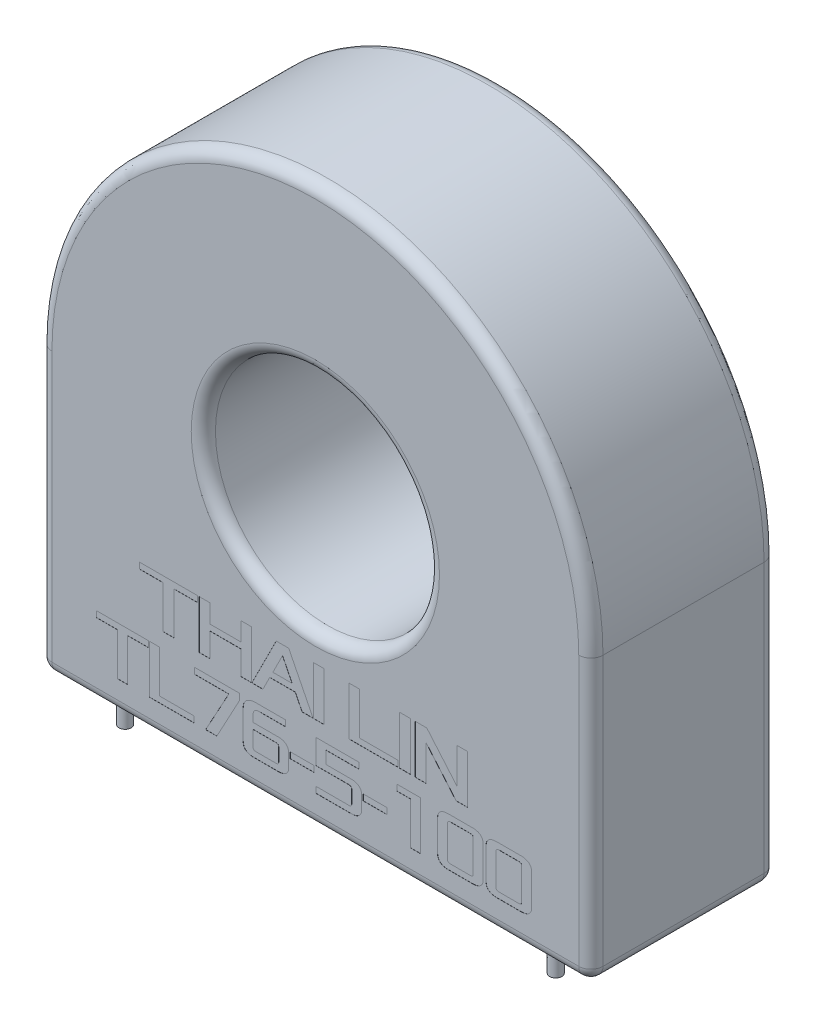
from build123d import *

# Parameters (mm, degrees)
SKETCH1_R           = 9.25
BOSS_EXTRUDE1_DEPTH = 7.65
SKETCH2_R           = 0.5
BOSS_EXTRUDE2_DEPTH = 2.5
FILLET1_R           = 1
SKETCH3_W           = 0.895944424
SKETCH3_H           = 4
SKETCH3_W_2         = 1.965215774
SKETCH3_H_2         = 0.500882695
CUT_EXTRUDE1_DEPTH  = 0.01
SKETCH4_W           = 0.682539037
SKETCH4_H           = 0.809522518
SKETCH4_W_2         = 0.682539036
CUT_EXTRUDE2_DEPTH  = 0.01


with BuildPart() as part:
    # Sketch1 → Boss-Extrude1 (new, symmetric)
    with BuildSketch(Plane.XY):
        with BuildLine():
            Line((-22.75, 11.625), (-22.75, -11.625))
            Line((-22.75, -11.625), (22.75, -11.625))
            Line((22.75, -11.625), (22.75, 11.625))
            ThreePointArc((22.75, 11.625), (0, 34.375), (-22.75, 11.625))
        make_face()
        with Locations((0, 11.625)):
            Circle(SKETCH1_R, mode=Mode.SUBTRACT)
    extrude(amount=BOSS_EXTRUDE1_DEPTH, both=True)

    # Sketch2 → Boss-Extrude2 (add, symmetric)
    with BuildSketch(Plane.XZ.offset(11.625)):
        with Locations((17.78, 5.58)):
            Circle(SKETCH2_R)
        with Locations((0, -4.58)):
            Circle(SKETCH2_R)
        with Locations((-17.78, 5.58)):
            Circle(SKETCH2_R)
    extrude(amount=BOSS_EXTRUDE2_DEPTH, both=True)

    # Fillet1
    fillet1_edges = [part.edges().sort_by_distance(p)[0] for p in [
        (-22.75, 0, -7.65),
        (0, 34.375, -7.65),
        (22.75, 0, 7.65),
        (-22.75, 0, 7.65),
        (-22.75, -11.625, 0),
        (22.75, -11.625, 0),
        (0, -11.625, -7.65),
        (0, -11.625, 7.65),
        (22.75, 0, -7.65),
        (0, 34.375, 7.65),
        (-9.25, 11.625, 7.65),
    ]]
    fillet(fillet1_edges, radius=FILLET1_R)

    # Sketch3 → Cut-Extrude1 (cut)
    # profile 1 of 17: a face of its own
    with BuildSketch(Plane.XY.offset(7.65)):
        Polygon((-14.532518498, -0.353325513), (-12.582011443, -0.353325513), (-12.582011443, -3.852442817), (-11.686067881, -3.852442817), (-11.686067881, -0.353325513), (-9.735560826, -0.353325513), (-9.735560826, 0.147557183), (-14.532518498, 0.147557183), align=None)
    # profile 2 of 17: a face of its own
    with BuildSketch(Plane.XY.offset(7.65)):
        Polygon((-9.590829785, -3.852442817), (-8.694885362, -3.852442817), (-8.694885362, -1.877134176), (-6.14814987, -1.877134176), (-6.14814987, -3.852442817), (-5.252205447, -3.852442817), (-5.252205447, 0.147557183), (-6.14814987, 0.147557183), (-6.14814987, -1.37625148), (-8.694885362, -1.37625148), (-8.694885362, 0.147557183), (-9.590829785, 0.147557183), align=None)
    # profile 3 of 17: a face of its own
    with BuildSketch(Plane.XY.offset(7.65)):
        Polygon((-5.244161293, -3.852442817), (-4.329861111, -3.852442817), (-3.769090333, -2.723695022), (-1.66010458, -2.723695022), (-1.099333802, -3.852442817), (-0.18503362, -3.852442817), (-2.19649402, 0.147557183), (-3.232700893, 0.147557183), align=None)
        Polygon((-3.506990947, -2.222812327), (-2.714597456, -0.642503409), (-1.922203965, -2.222812327), align=None, mode=Mode.SUBTRACT)
    # profile 4 of 17: a face of its own
    with BuildSketch(Plane.XY.offset(7.65)):
        with Locations((0.282186518, -1.852442817)):
            Rectangle(SKETCH3_W, SKETCH3_H)
    # profile 5 of 17: a face of its own
    with BuildSketch(Plane.XY.offset(7.65)):
        Polygon((2.768958574, -3.852441956), (6.834476962, -3.852441956), (6.834476962, -3.351560122), (3.664902998, -3.351560122), (3.664902998, 0.147557183), (2.768958574, 0.147557183), align=None)
    # profile 6 of 17: a face of its own
    with BuildSketch(Plane.XY.offset(7.65)):
        with Locations((7.393297629, -1.852442817)):
            Rectangle(SKETCH3_W, SKETCH3_H)
    # profile 7 of 17: a face of its own
    with BuildSketch(Plane.XY.offset(7.65)):
        Polygon((8.243385382, -3.852442817), (9.139329806, -3.852442817), (9.139329806, -0.943216627), (11.623966601, -3.852442817), (12.582009721, -3.852442817), (12.582009721, 0.147557183), (11.686065297, 0.147557183), (11.686065297, -2.761482996), (9.201445726, 0.147557183), (8.243385382, 0.147557183), align=None)
    # profile 8 of 17: a face of its own
    with BuildSketch(Plane.XY.offset(7.65)):
        Polygon((-18.07948547, -5.603325513), (-16.332627005, -5.603325513), (-16.332627005, -9.102442817), (-15.50370112, -9.102442817), (-15.50370112, -5.603325513), (-13.756842655, -5.603325513), (-13.756842655, -5.102442817), (-18.07948547, -5.102442817), align=None)
    # profile 9 of 17: a face of its own
    with BuildSketch(Plane.XY.offset(7.65)):
        Polygon((-13.685714286, -9.102441956), (-10.018143395, -9.102441956), (-10.018143395, -8.601560122), (-12.856788401, -8.601560122), (-12.856788401, -5.102442817), (-13.685714286, -5.102442817), align=None)
    # profile 10 of 17: a face of its own
    with BuildSketch(Plane.XY.offset(7.65)):
        Polygon((-9.988555101, -5.603325513), (-7.149910094, -5.603325513), (-9.060536541, -9.102442817), (-8.132517981, -9.102442817), (-6.253964809, -5.603325513), (-6.253964809, -5.102442817), (-9.988555101, -5.102442817), align=None)
    # profile 11 of 17: a face of its own
    with BuildSketch(Plane.XY.offset(7.65)):
        with BuildLine():
            add(Edge.make_bspline(
                [(-5.965079365, -8.386535527), (-5.964178551, -8.415925924), (-5.962440446, -8.4726342), (-5.95063423, -8.554660449), (-5.932548182, -8.630769718), (-5.906361096, -8.701259807), (-5.874585792, -8.766930613), (-5.832868082, -8.825283111), (-5.785951405, -8.87921949), (-5.731077978, -8.926583878), (-5.669764295, -8.967934365), (-5.603097775, -9.004373214), (-5.530557139, -9.03541711), (-5.451788042, -9.059642076), (-5.36750894, -9.079109267), (-5.277652274, -9.093183873), (-5.181857154, -9.100984664), (-5.116181002, -9.101946627), (-5.082363316, -9.102441956)],
                knots=[0, 0, 0, 0, 1.090546724, 2.104191533, 3.069975193, 3.988060192, 4.890652559, 5.768308273, 6.641681885, 7.538652629, 8.449449058, 9.381940305, 10.354600579, 11.372463556, 12.436293852, 13.562670226, 14.744980438, 16, 16, 16, 16], degree=3))
            Line((-5.082363316, -9.102441956), (-3.084338831, -9.102441956))
            add(Edge.make_bspline(
                [(-3.084338831, -9.102441956), (-3.050744649, -9.101941333), (-2.985292226, -9.100965956), (-2.889719867, -9.093184015), (-2.79986319, -9.079109233), (-2.715584102, -9.059642082), (-2.636814963, -9.03541712), (-2.564274471, -9.004373172), (-2.497607443, -8.967934513), (-2.436295588, -8.926583343), (-2.38141553, -8.879221432), (-2.334522937, -8.825276058), (-2.292714561, -8.766957424), (-2.261244951, -8.701062772), (-2.233671092, -8.630980299), (-2.215940006, -8.554628837), (-2.204063879, -8.472886893), (-2.202314117, -8.416420771), (-2.201410935, -8.387274408)],
                knots=[0, 0, 0, 0, 1.247794276, 2.431110226, 3.558444758, 4.623180007, 5.641908834, 6.615396507, 7.548680983, 8.460252186, 9.357985943, 10.232102494, 11.11050479, 12.013864952, 12.936550513, 13.903155723, 14.917662794, 16, 16, 16, 16], degree=3))
            Line((-2.201410935, -8.387274408), (-2.20140749, -7.342130352))
            add(Edge.make_bspline(
                [(-2.20140749, -7.342130352), (-2.202318865, -7.313042769), (-2.204086166, -7.25663736), (-2.215893147, -7.174927589), (-2.233896753, -7.098392458), (-2.260792507, -7.028017), (-2.293007433, -6.962470097), (-2.334486014, -6.904281387), (-2.381426042, -6.850359776), (-2.436291347, -6.802986296), (-2.497613766, -6.76165761), (-2.564252609, -6.725137721), (-2.636983969, -6.694379354), (-2.715411588, -6.668858204), (-2.799797083, -6.649313706), (-2.889857784, -6.636986831), (-2.985449521, -6.627305701), (-3.051177641, -6.626609714), (-3.085008818, -6.62625148)],
                knots=[0, 0, 0, 0, 1.079603584, 2.093521595, 3.059565557, 3.99192505, 4.885013636, 5.762905899, 6.636514906, 7.533727405, 8.444769315, 9.377511891, 10.350434321, 11.371899559, 12.436016582, 13.561057118, 14.74464218, 16, 16, 16, 16], degree=3))
            Line((-3.085008818, -6.62625148), (-5.13615348, -6.62625148))
            Line((-5.13615348, -6.62625148), (-5.13615348, -6.037295593))
            add(Edge.make_bspline(
                [(-5.13615348, -6.037295593), (-5.134669543, -6.003911441), (-5.131863069, -5.940774166), (-5.109887248, -5.851914284), (-5.071662187, -5.775539215), (-5.016131625, -5.713430919), (-4.945922492, -5.664285665), (-4.860067415, -5.630843446), (-4.760163091, -5.608269116), (-4.688325623, -5.60561293), (-4.65026455, -5.604205625)],
                knots=[0, 0, 0, 0, 1.078341341, 2.039396853, 2.936100315, 3.811247336, 4.704924793, 5.680758394, 6.771214737, 8, 8, 8, 8], degree=3))
            Line((-4.65026455, -5.604205625), (-2.477723008, -5.603325513))
            Line((-2.477723008, -5.603325513), (-2.477723008, -5.102442817))
            Line((-2.477723008, -5.102442817), (-4.866177869, -5.102442817))
            add(Edge.make_bspline(
                [(-4.866177869, -5.102442817), (-4.908269619, -5.103563399), (-4.990162799, -5.105743589), (-5.109341208, -5.114696909), (-5.221051232, -5.132427713), (-5.325501701, -5.157485777), (-5.423722659, -5.187375359), (-5.513734389, -5.226680498), (-5.597083234, -5.271836678), (-5.672845167, -5.32471404), (-5.741022297, -5.384413088), (-5.800067642, -5.451821757), (-5.851043602, -5.526016104), (-5.890766339, -5.608882975), (-5.924528279, -5.697668163), (-5.946261716, -5.794495207), (-5.962237991, -5.897924134), (-5.964114467, -5.969511356), (-5.965079365, -6.006322027)],
                knots=[0, 0, 0, 0, 1.248360097, 2.428793654, 3.540639795, 4.597573295, 5.611896563, 6.58001487, 7.504387576, 8.418265567, 9.313545441, 10.184224061, 11.068921664, 11.973149494, 12.902398245, 13.878991678, 14.90936207, 16, 16, 16, 16], degree=3))
            Line((-5.965079365, -6.006322027), (-5.965079365, -8.386535527))
        make_face()
        with BuildLine():
            Line((-5.13615348, -8.417253326), (-5.13615348, -7.127134176))
            Line((-5.13615348, -7.127134176), (-3.246324198, -7.127134176))
            add(Edge.make_bspline(
                [(-3.246324198, -7.127134176), (-3.229833231, -7.127833524), (-3.198922817, -7.129144371), (-3.155549365, -7.138180282), (-3.118284754, -7.151811502), (-3.086532423, -7.171619732), (-3.062686671, -7.198943809), (-3.044472063, -7.231267482), (-3.034167153, -7.269724557), (-3.031663443, -7.29697756), (-3.030335097, -7.311436665)],
                knots=[0, 0, 0, 0, 1.228569347, 2.302811313, 3.287526345, 4.174798407, 5.059089855, 5.961383309, 6.918410039, 8, 8, 8, 8], degree=3))
            Line((-3.030335097, -7.311436665), (-3.030333375, -8.417253326))
            add(Edge.make_bspline(
                [(-3.030333375, -8.417253326), (-3.031661142, -8.431715422), (-3.034163665, -8.458972994), (-3.044483913, -8.497407893), (-3.062644979, -8.529812795), (-3.086793953, -8.556964482), (-3.117972463, -8.577956677), (-3.155600481, -8.591275855), (-3.19889718, -8.600657094), (-3.229863094, -8.601245948), (-3.24638448, -8.601560122)],
                knots=[0, 0, 0, 0, 1.080018298, 2.035574722, 2.936481959, 3.819414846, 4.717395756, 5.700597943, 6.773189523, 8, 8, 8, 8], degree=3))
            Line((-3.24638448, -8.601560122), (-4.920172991, -8.601560122))
            add(Edge.make_bspline(
                [(-4.920172991, -8.601560122), (-4.936962248, -8.601249004), (-4.968192673, -8.600670281), (-5.011551634, -8.591468092), (-5.048724441, -8.577722577), (-5.079681832, -8.556979089), (-5.103925391, -8.529829418), (-5.12172559, -8.497248415), (-5.133711047, -8.459205719), (-5.135310243, -8.431758791), (-5.13615348, -8.417253326)],
                knots=[0, 0, 0, 0, 1.246449489, 2.318574743, 3.280947022, 4.178537522, 5.061086541, 5.961602094, 6.922980187, 8, 8, 8, 8], degree=3))
        make_face(mode=Mode.SUBTRACT)
    # profile 12 of 17: a face of its own
    with BuildSketch(Plane.XY.offset(7.65)):
        with Locations((-1.09770637, -7.441066726)):
            Rectangle(SKETCH3_W_2, SKETCH3_H_2)
    # profile 13 of 17: a face of its own
    with BuildSketch(Plane.XY.offset(7.65)):
        with BuildLine():
            Line((0.062433862, -9.102441956), (2.943174396, -9.102441956))
            add(Edge.make_bspline(
                [(2.943174396, -9.102441956), (2.976768578, -9.101941333), (3.042221001, -9.100965956), (3.13779336, -9.093184015), (3.227650038, -9.079109233), (3.311929126, -9.059642082), (3.390698265, -9.03541712), (3.463238756, -9.004373172), (3.529905784, -8.967934513), (3.59121764, -8.926583343), (3.646097698, -8.879221432), (3.692990291, -8.825276058), (3.734798666, -8.766957424), (3.766268277, -8.701062772), (3.793842135, -8.630980299), (3.811573222, -8.554628837), (3.823449348, -8.472886893), (3.82519911, -8.416420771), (3.826102293, -8.387274408)],
                knots=[0, 0, 0, 0, 1.247794276, 2.431110226, 3.558444758, 4.623180007, 5.641908834, 6.615396507, 7.548680983, 8.460252186, 9.357985943, 10.232102494, 11.11050479, 12.013864952, 12.936550513, 13.903155723, 14.917662794, 16, 16, 16, 16], degree=3))
            Line((3.826102293, -8.387274408), (3.826105737, -7.342130352))
            add(Edge.make_bspline(
                [(3.826105737, -7.342130352), (3.825194362, -7.313042769), (3.823427062, -7.25663736), (3.811620081, -7.174927589), (3.793616474, -7.098392458), (3.76672072, -7.028017), (3.734505794, -6.962470097), (3.693027214, -6.904281387), (3.646087186, -6.850359776), (3.59122188, -6.802986296), (3.529899461, -6.76165761), (3.463260618, -6.725137721), (3.390529258, -6.694379354), (3.31210164, -6.668858204), (3.227716144, -6.649313706), (3.137655444, -6.636986831), (3.042063706, -6.627305701), (2.976335586, -6.626609714), (2.942504409, -6.62625148)],
                knots=[0, 0, 0, 0, 1.079603584, 2.093521595, 3.059565557, 3.99192505, 4.885013636, 5.762905899, 6.636514906, 7.533727405, 8.444769315, 9.377511891, 10.350434321, 11.371899559, 12.436016582, 13.561057118, 14.74464218, 16, 16, 16, 16], degree=3))
            Line((2.942504409, -6.62625148), (0.891359747, -6.62625148))
            Line((0.891359747, -6.62625148), (0.891359747, -5.603325513))
            Line((0.891359747, -5.603325513), (3.605051257, -5.603325513))
            Line((3.605051257, -5.603325513), (3.605051257, -5.102442817))
            Line((3.605051257, -5.102442817), (0.062433862, -5.102442817))
            Line((0.062433862, -5.102442817), (0.062433862, -7.127134176))
            Line((0.062433862, -7.127134176), (2.781189029, -7.127134176))
            add(Edge.make_bspline(
                [(2.781189029, -7.127134176), (2.797679997, -7.127833524), (2.82859041, -7.129144371), (2.871963862, -7.138180282), (2.909228473, -7.151811502), (2.940980804, -7.171619732), (2.964826556, -7.198943809), (2.983041164, -7.231267482), (2.993346074, -7.269724557), (2.995849785, -7.29697756), (2.997178131, -7.311436665)],
                knots=[0, 0, 0, 0, 1.228569347, 2.302811313, 3.287526345, 4.174798407, 5.059089855, 5.961383309, 6.918410039, 8, 8, 8, 8], degree=3))
            Line((2.997178131, -7.311436665), (2.997179853, -8.417253326))
            add(Edge.make_bspline(
                [(2.997179853, -8.417253326), (2.995852085, -8.431715422), (2.993349562, -8.458972994), (2.983029314, -8.497407893), (2.964868248, -8.529812795), (2.940719274, -8.556964482), (2.909540764, -8.577956677), (2.871912747, -8.591275855), (2.828616048, -8.600657094), (2.797650133, -8.601245948), (2.781128748, -8.601560122)],
                knots=[0, 0, 0, 0, 1.080018298, 2.035574722, 2.936481959, 3.819414846, 4.717395756, 5.700597943, 6.773189523, 8, 8, 8, 8], degree=3))
            Line((2.781128748, -8.601560122), (0.062433862, -8.601560122))
            Line((0.062433862, -8.601560122), (0.062433862, -9.102441956))
        make_face()
    # profile 14 of 17: a face of its own
    with BuildSketch(Plane.XY.offset(7.65)):
        with Locations((4.929806858, -7.441066726)):
            Rectangle(SKETCH3_W_2, SKETCH3_H_2)
    # profile 15 of 17: a face of its own
    with BuildSketch(Plane.XY.offset(7.65)):
        Polygon((6.747720493, -5.603325513), (7.839507034, -5.603325513), (7.839507034, -9.102442817), (8.668432919, -9.102442817), (8.668432919, -5.102442817), (6.747720493, -5.102442817), align=None)
    # profile 16 of 17: a face of its own
    with BuildSketch(Plane.XY.offset(7.65)):
        with BuildLine():
            add(Edge.make_bspline(
                [(10.091358025, -8.387409611), (10.092271424, -8.416798847), (10.094033739, -8.473502486), (10.105629104, -8.555298605), (10.124272571, -8.631229451), (10.149613594, -8.701754478), (10.182147427, -8.767078187), (10.223531608, -8.825300742), (10.270496363, -8.879214637), (10.325356554, -8.926585214), (10.386673885, -8.967933996), (10.453339391, -9.004373318), (10.525880315, -9.03541708), (10.60464933, -9.059642085), (10.688928455, -9.079109265), (10.778785114, -9.093183874), (10.874580236, -9.100984664), (10.940256387, -9.101946627), (10.974074074, -9.102441956)],
                knots=[0, 0, 0, 0, 1.091324182, 2.105602559, 3.061388645, 3.990302777, 4.883708783, 5.761913066, 6.63583257, 7.533363956, 8.444729669, 9.377803759, 10.351071984, 11.369571165, 12.434066396, 13.5611468, 14.744196001, 16, 16, 16, 16], degree=3))
            Line((10.974074074, -9.102441956), (12.972098559, -9.102441956))
            add(Edge.make_bspline(
                [(12.972098559, -9.102441956), (13.00569274, -9.101941333), (13.071145163, -9.100965956), (13.166717524, -9.093184015), (13.256574195, -9.079109231), (13.340853306, -9.05964209), (13.419622363, -9.03541709), (13.492163143, -9.004373278), (13.558829153, -8.96793414), (13.620144673, -8.926584691), (13.675011432, -8.879216537), (13.721952331, -8.825293838), (13.763425995, -8.767104304), (13.795660331, -8.701561929), (13.82237742, -8.631435435), (13.840672649, -8.555267841), (13.852336458, -8.473757651), (13.854110658, -8.417298834), (13.855026455, -8.388156242)],
                knots=[0, 0, 0, 0, 1.248585623, 2.432652029, 3.560701514, 4.626112014, 5.645486916, 6.619591972, 7.553468334, 8.465617653, 9.36392075, 10.238591664, 11.11755104, 12.011725211, 12.945218025, 13.90182591, 14.916976379, 16, 16, 16, 16], degree=3))
            Line((13.855026455, -8.388156242), (13.8550299, -5.817603477))
            add(Edge.make_bspline(
                [(13.8550299, -5.817603477), (13.854112557, -5.788462915), (13.852335303, -5.732006206), (13.840672863, -5.650497895), (13.822377366, -5.574330315), (13.795660345, -5.504203818), (13.763425991, -5.438661443), (13.721952332, -5.380471908), (13.675011432, -5.32654921), (13.620144673, -5.279181056), (13.558829153, -5.237831606), (13.492163143, -5.201392469), (13.419622363, -5.170348655), (13.340853307, -5.146123665), (13.256574193, -5.126656481), (13.16671753, -5.112581873), (13.070922409, -5.104781083), (13.005246258, -5.10381912), (12.971428571, -5.103323791)],
                knots=[0, 0, 0, 0, 1.082394717, 2.097023559, 3.053139899, 3.986153045, 4.879867752, 5.758375482, 6.632596953, 7.530438465, 8.442119083, 9.37551558, 10.3491201, 11.367971205, 12.432834253, 13.560304098, 14.743762081, 16, 16, 16, 16], degree=3))
            Line((12.971428571, -5.103323791), (10.974279032, -5.102442817))
            add(Edge.make_bspline(
                [(10.974279032, -5.102442817), (10.940395427, -5.10331105), (10.874663976, -5.104995352), (10.778783452, -5.11252725), (10.688928865, -5.126669955), (10.604649228, -5.146120303), (10.52588034, -5.170349507), (10.453339385, -5.201392218), (10.386673887, -5.237831805), (10.325356553, -5.279180519), (10.270496364, -5.326551114), (10.223531605, -5.380465004), (10.182147436, -5.43868756), (10.149613558, -5.504011269), (10.124272715, -5.574536294), (10.105628537, -5.65046715), (10.094071026, -5.73201659), (10.092281653, -5.788469804), (10.091358025, -5.817609505)],
                knots=[0, 0, 0, 0, 1.259172173, 2.442692089, 3.570220939, 4.635139714, 5.654044138, 6.627699609, 7.561144954, 8.472873283, 9.370761781, 10.245029003, 11.123582708, 12.017344185, 12.946627916, 13.902794293, 14.917476233, 16, 16, 16, 16], degree=3))
            Line((10.091358025, -5.817609505), (10.091358025, -8.387409611))
        make_face()
        with BuildLine():
            Line((10.920283909, -8.418002541), (10.920283909, -5.787010546))
            add(Edge.make_bspline(
                [(10.920283909, -5.787010546), (10.921141484, -5.772712006), (10.922775523, -5.745467314), (10.934762925, -5.707682312), (10.952229908, -5.675085245), (10.977089643, -5.648802462), (11.007668426, -5.628002708), (11.044899632, -5.614310691), (11.087973216, -5.605145539), (11.1189321, -5.604532632), (11.135449735, -5.604205625)],
                knots=[0, 0, 0, 0, 1.068687892, 2.03629688, 2.942648866, 3.814683618, 4.718091592, 5.68670121, 6.765775135, 8, 8, 8, 8], degree=3))
            Line((11.135449735, -5.604205625), (12.810113192, -5.603325513))
            add(Edge.make_bspline(
                [(12.810113192, -5.603325513), (12.826610696, -5.604015565), (12.857533379, -5.60530899), (12.900826, -5.614455591), (12.938509813, -5.627778683), (12.969309569, -5.648813863), (12.994076253, -5.675102237), (13.011902417, -5.707522083), (13.02228881, -5.7458961), (13.024780385, -5.773161473), (13.026102293, -5.787627142)],
                knots=[0, 0, 0, 0, 1.229193561, 2.303982665, 3.289199236, 4.189019928, 5.057591977, 5.960344992, 6.917859159, 8, 8, 8, 8], degree=3))
            Line((13.026102293, -5.787627142), (13.026104015, -8.418002541))
            add(Edge.make_bspline(
                [(13.026104015, -8.418002541), (13.024784896, -8.432514035), (13.022302191, -8.459826005), (13.011902045, -8.498243414), (12.994076389, -8.530664262), (12.969309376, -8.556949177), (12.938510504, -8.577998001), (12.900823069, -8.591263307), (12.857544399, -8.600660893), (12.826575753, -8.60124727), (12.81005291, -8.601560122)],
                knots=[0, 0, 0, 0, 1.085029602, 2.042125889, 2.944484921, 3.812677906, 4.712105896, 5.696892497, 6.771212539, 8, 8, 8, 8], degree=3))
            Line((12.81005291, -8.601560122), (11.136264399, -8.601560122))
            add(Edge.make_bspline(
                [(11.136264399, -8.601560122), (11.119473651, -8.601250355), (11.088240453, -8.600674144), (11.044899463, -8.591455672), (11.007668457, -8.577762891), (10.977089664, -8.55696333), (10.952229797, -8.530680458), (10.934763379, -8.498083577), (10.922711229, -8.460101229), (10.921121922, -8.432645352), (10.920283909, -8.418002541)],
                knots=[0, 0, 0, 0, 1.248967675, 2.323258931, 3.287575479, 4.186979369, 5.05514909, 5.957483945, 6.920804297, 8, 8, 8, 8], degree=3))
        make_face(mode=Mode.SUBTRACT)
    # profile 17 of 17: a face of its own
    with BuildSketch(Plane.XY.offset(7.65)):
        with BuildLine():
            add(Edge.make_bspline(
                [(14.092768959, -8.387409611), (14.093682359, -8.416798847), (14.095444674, -8.473502486), (14.107040039, -8.555298605), (14.125683506, -8.631229451), (14.151024529, -8.701754478), (14.183558361, -8.767078187), (14.224942542, -8.825300742), (14.271907298, -8.879214637), (14.326767489, -8.926585214), (14.38808482, -8.967933996), (14.454750326, -9.004373318), (14.52729125, -9.03541708), (14.606060265, -9.059642085), (14.69033939, -9.079109265), (14.780196049, -9.093183874), (14.875991171, -9.100984664), (14.941667322, -9.101946627), (14.975485009, -9.102441956)],
                knots=[0, 0, 0, 0, 1.091324182, 2.105602559, 3.061388645, 3.990302777, 4.883708783, 5.761913066, 6.63583257, 7.533363956, 8.444729669, 9.377803759, 10.351071984, 11.369571165, 12.434066396, 13.5611468, 14.744196001, 16, 16, 16, 16], degree=3))
            Line((14.975485009, -9.102441956), (16.973509493, -9.102441956))
            add(Edge.make_bspline(
                [(16.973509493, -9.102441956), (17.007103675, -9.101941333), (17.072556098, -9.100965956), (17.168128459, -9.093184015), (17.25798513, -9.079109231), (17.342264241, -9.05964209), (17.421033297, -9.03541709), (17.493574078, -9.004373278), (17.560240087, -8.96793414), (17.621555608, -8.926584691), (17.676422367, -8.879216537), (17.723363266, -8.825293838), (17.76483693, -8.767104304), (17.797071266, -8.701561929), (17.823788355, -8.631435435), (17.842083583, -8.555267841), (17.853747393, -8.473757651), (17.855521593, -8.417298834), (17.85643739, -8.388156242)],
                knots=[0, 0, 0, 0, 1.248585623, 2.432652029, 3.560701514, 4.626112014, 5.645486916, 6.619591972, 7.553468334, 8.465617653, 9.36392075, 10.238591664, 11.11755104, 12.011725211, 12.945218025, 13.90182591, 14.916976379, 16, 16, 16, 16], degree=3))
            Line((17.85643739, -8.388156242), (17.856440834, -5.817603477))
            add(Edge.make_bspline(
                [(17.856440834, -5.817603477), (17.855523491, -5.788462915), (17.853746238, -5.732006206), (17.842083798, -5.650497895), (17.8237883, -5.574330315), (17.797071279, -5.504203818), (17.764836926, -5.438661443), (17.723363267, -5.380471908), (17.676422367, -5.32654921), (17.621555608, -5.279181056), (17.560240087, -5.237831606), (17.493574078, -5.201392469), (17.421033297, -5.170348655), (17.342264241, -5.146123665), (17.257985128, -5.126656481), (17.168128465, -5.112581873), (17.072333344, -5.104781083), (17.006657193, -5.10381912), (16.972839506, -5.103323791)],
                knots=[0, 0, 0, 0, 1.082394717, 2.097023559, 3.053139899, 3.986153045, 4.879867752, 5.758375482, 6.632596953, 7.530438465, 8.442119083, 9.37551558, 10.3491201, 11.367971205, 12.432834253, 13.560304098, 14.743762081, 16, 16, 16, 16], degree=3))
            Line((16.972839506, -5.103323791), (14.975689966, -5.102442817))
            add(Edge.make_bspline(
                [(14.975689966, -5.102442817), (14.941806362, -5.10331105), (14.876074911, -5.104995352), (14.780194387, -5.11252725), (14.690339799, -5.126669955), (14.606060162, -5.146120303), (14.527291275, -5.170349507), (14.45475032, -5.201392218), (14.388084821, -5.237831805), (14.326767488, -5.279180519), (14.271907299, -5.326551114), (14.22494254, -5.380465004), (14.183558371, -5.43868756), (14.151024493, -5.504011269), (14.12568365, -5.574536294), (14.107039472, -5.65046715), (14.095481961, -5.73201659), (14.093692588, -5.788469804), (14.092768959, -5.817609505)],
                knots=[0, 0, 0, 0, 1.259172173, 2.442692089, 3.570220939, 4.635139714, 5.654044138, 6.627699609, 7.561144954, 8.472873283, 9.370761781, 10.245029003, 11.123582708, 12.017344185, 12.946627916, 13.902794293, 14.917476233, 16, 16, 16, 16], degree=3))
            Line((14.092768959, -5.817609505), (14.092768959, -8.387409611))
        make_face()
        with BuildLine():
            Line((14.921694844, -8.418002541), (14.921694844, -5.787010546))
            add(Edge.make_bspline(
                [(14.921694844, -5.787010546), (14.922552419, -5.772712006), (14.924186458, -5.745467314), (14.936173859, -5.707682312), (14.953640843, -5.675085245), (14.978500578, -5.648802462), (15.009079361, -5.628002708), (15.046310566, -5.614310691), (15.089384151, -5.605145539), (15.120343035, -5.604532632), (15.13686067, -5.604205625)],
                knots=[0, 0, 0, 0, 1.068687892, 2.03629688, 2.942648866, 3.814683618, 4.718091592, 5.68670121, 6.765775135, 8, 8, 8, 8], degree=3))
            Line((15.13686067, -5.604205625), (16.811524126, -5.603325513))
            add(Edge.make_bspline(
                [(16.811524126, -5.603325513), (16.82802163, -5.604015565), (16.858944314, -5.60530899), (16.902236935, -5.614455591), (16.939920748, -5.627778683), (16.970720504, -5.648813863), (16.995487187, -5.675102237), (17.013313351, -5.707522083), (17.023699745, -5.7458961), (17.02619132, -5.773161473), (17.027513228, -5.787627142)],
                knots=[0, 0, 0, 0, 1.229193561, 2.303982665, 3.289199236, 4.189019928, 5.057591977, 5.960344992, 6.917859159, 8, 8, 8, 8], degree=3))
            Line((17.027513228, -5.787627142), (17.02751495, -8.418002541))
            add(Edge.make_bspline(
                [(17.02751495, -8.418002541), (17.02619583, -8.432514035), (17.023713126, -8.459826005), (17.01331298, -8.498243414), (16.995487323, -8.530664262), (16.970720311, -8.556949177), (16.939921439, -8.577998001), (16.902234004, -8.591263307), (16.858955334, -8.600660893), (16.827986688, -8.60124727), (16.811463845, -8.601560122)],
                knots=[0, 0, 0, 0, 1.085029602, 2.042125889, 2.944484921, 3.812677906, 4.712105896, 5.696892497, 6.771212539, 8, 8, 8, 8], degree=3))
            Line((16.811463845, -8.601560122), (15.137675333, -8.601560122))
            add(Edge.make_bspline(
                [(15.137675333, -8.601560122), (15.120884586, -8.601250355), (15.089651388, -8.600674144), (15.046310398, -8.591455672), (15.009079392, -8.577762891), (14.978500598, -8.55696333), (14.953640732, -8.530680458), (14.936174313, -8.498083577), (14.924122164, -8.460101229), (14.922532857, -8.432645352), (14.921694844, -8.418002541)],
                knots=[0, 0, 0, 0, 1.248967675, 2.323258931, 3.287575479, 4.186979369, 5.05514909, 5.957483945, 6.920804297, 8, 8, 8, 8], degree=3))
        make_face(mode=Mode.SUBTRACT)
    extrude(amount=-CUT_EXTRUDE1_DEPTH, mode=Mode.SUBTRACT)

    # Sketch4 → Cut-Extrude2 (cut)
    # profile 1 of 6: a face of its own
    with BuildSketch(Plane.XZ.offset(11.625)):
        Polygon((-20.51172121, 2.121201377), (-20.003094908, 2.121201377), (-20.003094908, 1.359296615), (-19.542776802, 1.359296615), (-19.542776802, 2.121201377), (-18.860237765, 2.121201377), (-18.860237765, 1.359296615), (-18.399919013, 1.359296615), (-18.399919013, 2.121201377), (-17.891292711, 2.121201377), (-17.891292711, 2.454535356), (-18.399919013, 2.454535356), (-18.399919013, 3.264057874), (-17.891292711, 3.264057874), (-17.891292711, 3.597391853), (-18.399919013, 3.597391853), (-18.399919013, 4.359296615), (-18.860237765, 4.359296615), (-18.860237765, 3.597391853), (-19.542776802, 3.597391853), (-19.542776802, 4.359296615), (-20.003094908, 4.359296615), (-20.003094908, 3.597391853), (-20.51172121, 3.597391853), (-20.51172121, 3.264057874), (-20.003094908, 3.264057874), (-20.003094908, 2.454535356), (-20.51172121, 2.454535356), align=None)
        with Locations((-19.201507283, 2.859296615)):
            Rectangle(SKETCH4_W, SKETCH4_H, mode=Mode.SUBTRACT)
    # profile 2 of 6: a face of its own
    with BuildSketch(Plane.XZ.offset(11.625)):
        with BuildLine():
            Line((-17.806261115, 1.359297261), (-15.31421377, 1.359297261))
            Line((-15.31421377, 1.359297261), (-15.31421377, 1.734958637))
            Line((-15.31421377, 1.734958637), (-17.261304363, 1.734958637))
            Line((-17.261304363, 1.734958637), (-17.261304363, 2.702569314))
            add(Edge.make_bspline(
                [(-17.261304363, 2.702569314), (-17.260813843, 2.713410697), (-17.259889907, 2.733831379), (-17.252545127, 2.762446148), (-17.240403536, 2.786626291), (-17.224654771, 2.80708354), (-17.203600247, 2.822139998), (-17.178721083, 2.83249803), (-17.149666651, 2.83939422), (-17.128844844, 2.839866393), (-17.117777448, 2.840117367)],
                knots=[0, 0, 0, 0, 1.146140253, 2.15885418, 3.097687754, 3.993824496, 4.861583543, 5.801864819, 6.831627206, 8, 8, 8, 8], degree=3))
            Line((-17.117777448, 2.840117367), (-15.895227767, 2.840778097))
            add(Edge.make_bspline(
                [(-15.895227767, 2.840778097), (-15.873044614, 2.840768377), (-15.82978166, 2.840749422), (-15.767034905, 2.848234568), (-15.707485419, 2.857273583), (-15.65241537, 2.872960792), (-15.600554983, 2.891220266), (-15.552896145, 2.91470548), (-15.508491264, 2.941477222), (-15.468264176, 2.972973521), (-15.432514837, 3.008733129), (-15.401081673, 3.048836201), (-15.374306633, 3.093368413), (-15.353664961, 3.142859074), (-15.335949941, 3.195760675), (-15.324686744, 3.253351194), (-15.316172915, 3.314734838), (-15.315310483, 3.357280167), (-15.314867395, 3.379138531)],
                knots=[0, 0, 0, 0, 1.17725594, 2.295957155, 3.352944716, 4.372886693, 5.332411035, 6.269957519, 7.189856749, 8.082439236, 8.976787012, 9.869369499, 10.783210544, 11.727389576, 12.712515132, 13.741493687, 14.839655177, 16, 16, 16, 16], degree=3))
            Line((-15.314867395, 3.379138531), (-15.31421377, 3.820894845))
            add(Edge.make_bspline(
                [(-15.31421377, 3.820894845), (-15.314942364, 3.842543705), (-15.316366752, 3.884866865), (-15.32464591, 3.946065255), (-15.335960091, 4.003653498), (-15.35366241, 4.056555675), (-15.374307287, 4.10604616), (-15.401081484, 4.150578528), (-15.432514963, 4.190681155), (-15.468263857, 4.226442389), (-15.508492424, 4.257932573), (-15.552891644, 4.284727953), (-15.600572293, 4.308122043), (-15.652293581, 4.326718634), (-15.70768631, 4.340973211), (-15.766891113, 4.351750271), (-15.829962431, 4.357524562), (-15.873278008, 4.358258448), (-15.895555226, 4.358635885)],
                knots=[0, 0, 0, 0, 1.150395952, 2.249004896, 3.278402715, 4.263929667, 5.208493411, 6.122706807, 7.015652983, 7.910365167, 8.803311343, 9.723585392, 10.661513885, 11.621429193, 12.63875548, 13.698183835, 14.816175116, 16, 16, 16, 16], degree=3))
            Line((-15.895555226, 4.358635885), (-17.624608864, 4.359296615))
            Line((-17.624608864, 4.359296615), (-17.624608864, 3.983634594))
            Line((-17.624608864, 3.983634594), (-16.00307592, 3.983634594))
            add(Edge.make_bspline(
                [(-16.00307592, 3.983634594), (-15.992117988, 3.983073385), (-15.971432664, 3.98201399), (-15.942227888, 3.975587481), (-15.917695935, 3.964193424), (-15.896455156, 3.949332058), (-15.880757928, 3.928804238), (-15.868419068, 3.904466967), (-15.861483635, 3.875519617), (-15.859973762, 3.854920706), (-15.859179564, 3.844085621)],
                knots=[0, 0, 0, 0, 1.156202653, 2.182567429, 3.129214472, 3.994110424, 4.887290441, 5.823026416, 6.854905793, 8, 8, 8, 8], degree=3))
            Line((-15.859179564, 3.844085621), (-15.859170522, 3.35592967))
            add(Edge.make_bspline(
                [(-15.859170522, 3.35592967), (-15.859949297, 3.344888067), (-15.861417189, 3.32407605), (-15.868471853, 3.294995276), (-15.880509616, 3.270607713), (-15.896906697, 3.250787217), (-15.917422627, 3.23508315), (-15.942276001, 3.223918799), (-15.971485777, 3.21721159), (-15.992297449, 3.216707864), (-16.003359459, 3.216440118)],
                knots=[0, 0, 0, 0, 1.162461453, 2.19109177, 3.123881412, 3.996272323, 4.87234941, 5.816015764, 6.839148844, 8, 8, 8, 8], degree=3))
            Line((-16.003359459, 3.216440118), (-17.225354979, 3.216440118))
            add(Edge.make_bspline(
                [(-17.225354979, 3.216440118), (-17.247719372, 3.216167481), (-17.291155029, 3.21563797), (-17.354128025, 3.208450416), (-17.413508173, 3.198983626), (-17.468989508, 3.184658597), (-17.520421641, 3.16510828), (-17.568264116, 3.141919969), (-17.612641073, 3.115063714), (-17.652868779, 3.083585043), (-17.688642483, 3.047836472), (-17.719860509, 3.007820622), (-17.746839572, 2.963886553), (-17.7675999, 2.914851754), (-17.78517417, 2.862113783), (-17.796389937, 2.804742775), (-17.805004834, 2.743592083), (-17.805838822, 2.701262837), (-17.806269512, 2.679403081)],
                knots=[0, 0, 0, 0, 1.188934453, 2.309123595, 3.367517, 4.385781481, 5.350652488, 6.289445953, 7.210568694, 8.104338359, 8.99987566, 9.893645325, 10.798653009, 11.733336022, 12.719771842, 13.750118988, 14.838111863, 16, 16, 16, 16], degree=3))
            Line((-17.806269512, 2.679403081), (-17.806261115, 1.359297261))
        make_face()
    # profile 3 of 6: a face of its own
    with BuildSketch(Plane.XZ.offset(11.625)):
        Polygon((15.831135932, 2.121201377), (16.339762235, 2.121201377), (16.339762235, 1.359296615), (16.800080341, 1.359296615), (16.800080341, 2.121201377), (17.482619377, 2.121201377), (17.482619377, 1.359296615), (17.942938129, 1.359296615), (17.942938129, 2.121201377), (18.451564432, 2.121201377), (18.451564432, 2.454535356), (17.942938129, 2.454535356), (17.942938129, 3.264057874), (18.451564432, 3.264057874), (18.451564432, 3.597391853), (17.942938129, 3.597391853), (17.942938129, 4.359296615), (17.482619377, 4.359296615), (17.482619377, 3.597391853), (16.800080341, 3.597391853), (16.800080341, 4.359296615), (16.339762235, 4.359296615), (16.339762235, 3.597391853), (15.831135932, 3.597391853), (15.831135932, 3.264057874), (16.339762235, 3.264057874), (16.339762235, 2.454535356), (15.831135932, 2.454535356), align=None)
        with Locations((17.141349859, 2.859296615)):
            Rectangle(SKETCH4_W_2, SKETCH4_H, mode=Mode.SUBTRACT)
    # profile 4 of 6: a face of its own
    with BuildSketch(Plane.XZ.offset(11.625)):
        Polygon((18.995172856, 3.983634594), (19.721781859, 3.983634594), (19.721781859, 1.359296615), (20.266738611, 1.359296615), (20.266738611, 4.359296615), (18.995172856, 4.359296615), align=None)
    # profile 5 of 6: a face of its own
    with BuildSketch(Plane.XZ.offset(11.625)):
        Polygon((-2.451023271, -2.924591128), (-1.942396968, -2.924591128), (-1.942396968, -3.68649589), (-1.482078862, -3.68649589), (-1.482078862, -2.924591128), (-0.799539826, -2.924591128), (-0.799539826, -3.68649589), (-0.339221074, -3.68649589), (-0.339221074, -2.924591128), (0.169405229, -2.924591128), (0.169405229, -2.591257149), (-0.339221074, -2.591257149), (-0.339221074, -1.781734631), (0.169405229, -1.781734631), (0.169405229, -1.448400652), (-0.339221074, -1.448400652), (-0.339221074, -0.68649589), (-0.799539826, -0.68649589), (-0.799539826, -1.448400652), (-1.482078862, -1.448400652), (-1.482078862, -0.68649589), (-1.942396968, -0.68649589), (-1.942396968, -1.448400652), (-2.451023271, -1.448400652), (-2.451023271, -1.781734631), (-1.942396968, -1.781734631), (-1.942396968, -2.591257149), (-2.451023271, -2.591257149), align=None)
        with Locations((-1.140809344, -2.18649589)):
            Rectangle(SKETCH4_W_2, SKETCH4_H, mode=Mode.SUBTRACT)
    # profile 6 of 6: a face of its own
    with BuildSketch(Plane.XZ.offset(11.625)):
        with BuildLine():
            Line((0.31234401, -3.686495244), (2.165196968, -3.686495244))
            add(Edge.make_bspline(
                [(2.165196968, -3.686495244), (2.187456083, -3.686117325), (2.230753537, -3.685382214), (2.293806823, -3.679609641), (2.353011643, -3.668832573), (2.408404314, -3.654577967), (2.460125802, -3.635981491), (2.507805737, -3.612586983), (2.552207537, -3.585793115), (2.592426779, -3.554297467), (2.6282103, -3.518556527), (2.659397368, -3.478526951), (2.686599604, -3.434468598), (2.706853945, -3.385229205), (2.724887115, -3.332663487), (2.735918674, -3.275447949), (2.744574779, -3.21431171), (2.74540289, -3.171980402), (2.745830545, -3.150119582)],
                knots=[0, 0, 0, 0, 1.184591709, 2.304215717, 3.365191274, 4.384003276, 5.345320455, 6.284618709, 7.206236738, 8.100486983, 8.996505814, 9.890756059, 10.796250366, 11.742193562, 12.718008063, 13.748909226, 14.837487115, 16, 16, 16, 16], degree=3))
            Line((2.745830545, -3.150119582), (2.74648417, -2.481453288))
            add(Edge.make_bspline(
                [(2.74648417, -2.481453288), (2.744708247, -2.449214672), (2.741354624, -2.388335817), (2.726725534, -2.30248528), (2.701941591, -2.228121704), (2.667042993, -2.165188908), (2.624119027, -2.114004626), (2.579673794, -2.068275388), (2.528545261, -2.033212029), (2.492091765, -2.015425804), (2.474005148, -2.006601064)],
                knots=[0, 0, 0, 0, 1.330908233, 2.513264541, 3.579924902, 4.548633975, 5.460195297, 6.328093389, 7.170473682, 8, 8, 8, 8], degree=3))
            add(Edge.make_bspline(
                [(2.474005148, -2.006601064), (2.492168667, -1.997879604), (2.529007756, -1.980190817), (2.578994376, -1.943408579), (2.62462786, -1.898600084), (2.666961442, -1.846560793), (2.701973217, -1.783098441), (2.726676894, -1.70804627), (2.741505696, -1.621579122), (2.744333713, -1.560234164), (2.745830545, -1.527765085)],
                knots=[0, 0, 0, 0, 0.82484488, 1.672943141, 2.529622554, 3.443089913, 4.41423265, 5.483430246, 6.668012739, 8, 8, 8, 8], degree=3))
            Line((2.745830545, -1.527765085), (2.74648417, -1.22489766))
            add(Edge.make_bspline(
                [(2.74648417, -1.22489766), (2.745755576, -1.2032488), (2.744331187, -1.16092564), (2.73605203, -1.09972725), (2.724737848, -1.042139006), (2.70703553, -0.98923683), (2.686390653, -0.939746345), (2.659616456, -0.895213977), (2.628182977, -0.85511135), (2.592434083, -0.819350116), (2.552205516, -0.787859932), (2.507806296, -0.761064552), (2.460125647, -0.737670462), (2.408404359, -0.719073871), (2.35301163, -0.704819294), (2.293806827, -0.694042234), (2.230735509, -0.688267942), (2.187419931, -0.687534057), (2.165142714, -0.687156619)],
                knots=[0, 0, 0, 0, 1.150395952, 2.249004896, 3.278402715, 4.263929667, 5.208493411, 6.122706807, 7.015652983, 7.910365167, 8.803311343, 9.723585392, 10.661513885, 11.621429193, 12.63875548, 13.698183835, 14.816175116, 16, 16, 16, 16], degree=3))
            Line((2.165142714, -0.687156619), (0.31234401, -0.68649589))
            Line((0.31234401, -0.68649589), (0.31234401, -1.062157911))
            Line((0.31234401, -1.062157911), (2.056205617, -1.062157911))
            add(Edge.make_bspline(
                [(2.056205617, -1.062157911), (2.067186853, -1.062744765), (2.088103163, -1.063862565), (2.117649051, -1.070039535), (2.142405691, -1.081817163), (2.164206273, -1.096210808), (2.179919295, -1.117018189), (2.192285133, -1.141316495), (2.199212468, -1.170275542), (2.200723545, -1.190872714), (2.201518375, -1.201706884)],
                knots=[0, 0, 0, 0, 1.153028026, 2.196209313, 3.137585404, 4.016415305, 4.904622076, 5.835147853, 6.861281702, 8, 8, 8, 8], degree=3))
            Line((2.201518375, -1.201706884), (2.201527418, -1.689862834))
            add(Edge.make_bspline(
                [(2.201527418, -1.689862834), (2.200747945, -1.700903486), (2.199278737, -1.721713707), (2.192232804, -1.750806395), (2.180166266, -1.775154694), (2.163755598, -1.795247833), (2.142672804, -1.810492942), (2.11760107, -1.822037572), (2.088080544, -1.828493373), (2.067069433, -1.829056259), (2.05601573, -1.829352387)],
                knots=[0, 0, 0, 0, 1.156521359, 2.17989545, 3.107918604, 3.975851661, 4.865860744, 5.80470503, 6.84508071, 8, 8, 8, 8], degree=3))
            Line((2.05601573, -1.829352387), (0.639318061, -1.829352387))
            Line((0.639318061, -1.829352387), (0.639318061, -2.205014408))
            Line((0.639318061, -2.205014408), (2.056205617, -2.205014408))
            add(Edge.make_bspline(
                [(2.056205617, -2.205014408), (2.067196862, -2.205579216), (2.088132221, -2.206655023), (2.117461407, -2.213098745), (2.142566554, -2.223873623), (2.164181569, -2.238457066), (2.179934984, -2.259197683), (2.192147838, -2.283334046), (2.199303299, -2.312003216), (2.200749646, -2.332400281), (2.201518375, -2.343241276)],
                knots=[0, 0, 0, 0, 1.15763071, 2.204974548, 3.140653969, 4.022990617, 4.914741553, 5.848980358, 6.856737935, 8, 8, 8, 8], degree=3))
            Line((2.201518375, -2.343241276), (2.201527418, -3.172603771))
            add(Edge.make_bspline(
                [(2.201527418, -3.172603771), (2.200755953, -3.183446998), (2.199304533, -3.203847241), (2.192138179, -3.232499643), (2.17996929, -3.25669742), (2.163979688, -3.277325856), (2.142802742, -3.29275167), (2.117423257, -3.30332557), (2.088106937, -3.310037709), (2.067078531, -3.310559408), (2.05601573, -3.310833868)],
                knots=[0, 0, 0, 0, 1.140706733, 2.146104159, 3.078154991, 3.96781746, 4.861689238, 5.795177313, 6.840068288, 8, 8, 8, 8], degree=3))
            Line((2.05601573, -3.310833868), (0.31234401, -3.310833868))
            Line((0.31234401, -3.310833868), (0.31234401, -3.686495244))
        make_face()
    extrude(amount=-CUT_EXTRUDE2_DEPTH, mode=Mode.SUBTRACT)


solid = part.part
